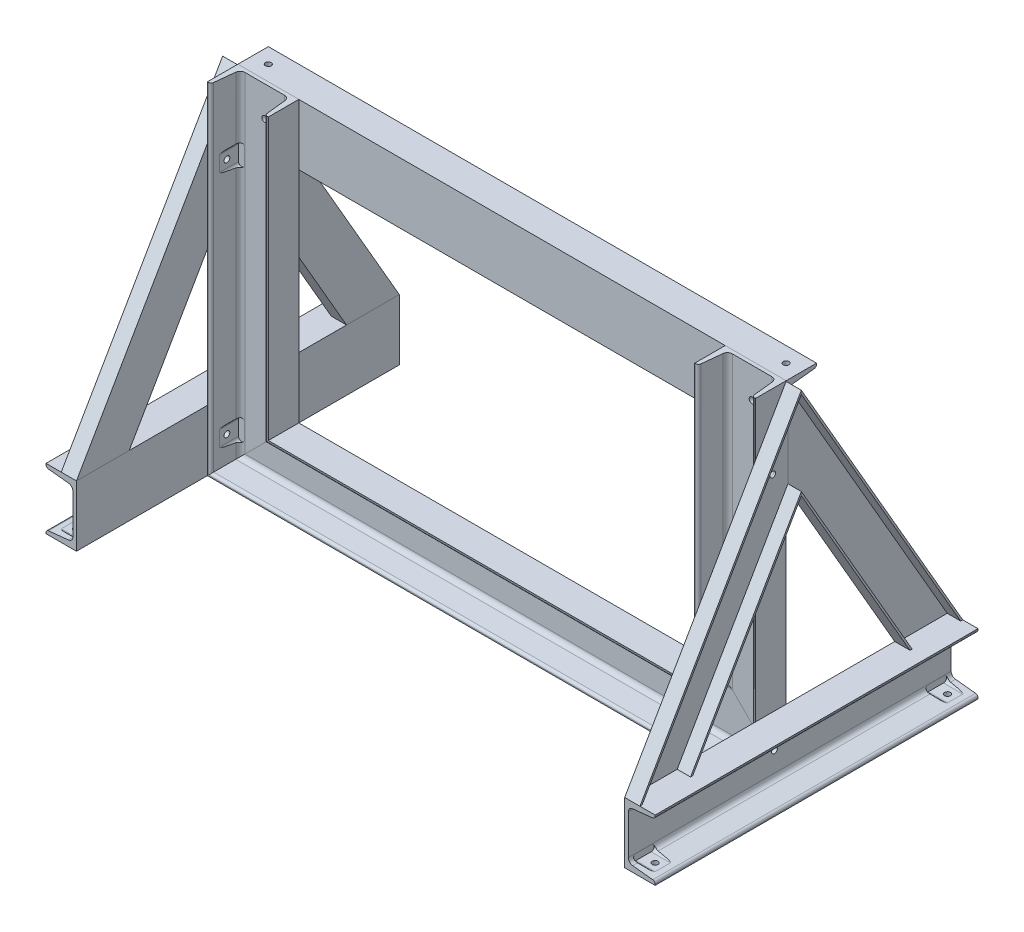
from build123d import *

# Parameters (mm, degrees)
STRUCTURAL_MEMBER1_DEPTH   = 772.803398875
STRUCTURAL_MEMBER1_2_DEPTH = 1325.60679775
STRUCTURAL_MEMBER1_3_DEPTH = 772.803398875
STRUCTURAL_MEMBER1_4_DEPTH = 900
STRUCTURAL_START           = -265
STRUCTURAL_MEMBER2_DEPTH   = 530
STRUCTURAL_MEMBER3_DEPTH   = 674.014380264
STRUCTURAL_MEMBER3_2_DEPTH = 674.014380264
SKETCH19_R                 = 4.7625
CUT_EXTRUDE1_DEPTH         = 30
CUT_EXTRUDE2_DEPTH         = 797.131270583
CUT_EXTRUDE2_DEPTH_BACK    = 797.131270583
SKETCH20_R                 = 4.7625
CUT_EXTRUDE6_DEPTH         = 20
CUT_EXTRUDE6_DEPTH_BACK    = 20
SKETCH22_R                 = 4.7625
CUT_EXTRUDE7_DEPTH         = 20
CUT_EXTRUDE7_DEPTH_BACK    = 20
SKETCH23_R                 = 4.7625
CUT_EXTRUDE8_DEPTH         = 40
CUT_EXTRUDE9_DEPTH         = 1469.354835335
CUT_EXTRUDE10_DEPTH        = 1469.354835353
SKETCH27_R                 = 4.7625
CUT_EXTRUDE11_DEPTH        = 40
CUT_EXTRUDE12_DEPTH        = 729.340398583


# Read off the part's stored shape, not the designer's step: Structural Member2
with BuildPart() as part:
    # Sketch110 → Structural Member1 (new body)
    with BuildSketch(Plane(origin=(-350, 0, 0), x_dir=(0, 0, 1), z_dir=(0, -1, 0))):
        with BuildLine():
            Line((50, 100), (0, 100))
            Line((0, 100), (0, 0))
            Line((0, 0), (50, 0))
            Line((50, 0), (50, 1.629852671))
            ThreePointArc((50, 1.629852671), (48.844151715, 4.6409404), (45.970378085, 6.1052012))
            Line((45.970378085, 6.1052012), (13.063772294, 9.563824837))
            ThreePointArc((13.063772294, 9.563824837), (7.954841396, 12.166955149), (5.9, 17.52))
            Line((5.9, 17.52), (5.9, 82.48))
            ThreePointArc((5.9, 82.48), (7.954841396, 87.833044851), (13.063772294, 90.436175163))
            Line((13.063772294, 90.436175163), (45.970378085, 93.8947988))
            ThreePointArc((45.970378085, 93.8947988), (48.844151715, 95.3590596), (50, 98.370147329))
            Line((50, 98.370147329), (50, 100))
        make_face()
    extrude(amount=STRUCTURAL_MEMBER1_DEPTH)

    # Structural Member1 mitre 1
    split(bisect_by=Plane(origin=(-450, -560, 0), x_dir=(-0.707106781, -0.707106781, 0), z_dir=(-0.707106781, 0.707106781, 0)), keep=Keep.TOP)


with BuildPart() as body_2:
    # Sketch110 on segment 2 (carried to segment 2) → Structural Member1 2 (new body)
    with BuildSketch(Plane(origin=(-662.803398875, -460, 0), x_dir=(0, 0, 1), z_dir=(1, 0, 0))):
        with BuildLine():
            Line((50, 100), (0, 100))
            Line((0, 100), (0, 0))
            Line((0, 0), (50, 0))
            Line((50, 0), (50, 1.629852671))
            ThreePointArc((50, 1.629852671), (48.844151715, 4.6409404), (45.970378085, 6.1052012))
            Line((45.970378085, 6.1052012), (13.063772294, 9.563824837))
            ThreePointArc((13.063772294, 9.563824837), (7.954841396, 12.166955149), (5.9, 17.52))
            Line((5.9, 17.52), (5.9, 82.48))
            ThreePointArc((5.9, 82.48), (7.954841396, 87.833044851), (13.063772294, 90.436175163))
            Line((13.063772294, 90.436175163), (45.970378085, 93.8947988))
            ThreePointArc((45.970378085, 93.8947988), (48.844151715, 95.3590596), (50, 98.370147329))
            Line((50, 98.370147329), (50, 100))
        make_face()
    extrude(amount=STRUCTURAL_MEMBER1_2_DEPTH)

    # Structural Member1 2 mitre 1
    split(bisect_by=Plane(origin=(-450, -560, 0), x_dir=(0.707106781, 0.707106781, 0), z_dir=(0.707106781, -0.707106781, 0)), keep=Keep.TOP)

    # Structural Member1 2 mitre 2
    split(bisect_by=Plane(origin=(450, -560, 0), x_dir=(0.707106781, -0.707106781, 0), z_dir=(-0.707106781, -0.707106781, 0)), keep=Keep.TOP)


with BuildPart() as body_3:
    # Sketch110 on segment 3 (carried to segment 3) → Structural Member1 3 (new body)
    with BuildSketch(Plane(origin=(350, -772.803398875, 0), x_dir=(0, 0, 1), z_dir=(0, 1, 0))):
        with BuildLine():
            Line((50, 100), (0, 100))
            Line((0, 100), (0, 0))
            Line((0, 0), (50, 0))
            Line((50, 0), (50, 1.629852671))
            ThreePointArc((50, 1.629852671), (48.844151715, 4.6409404), (45.970378085, 6.1052012))
            Line((45.970378085, 6.1052012), (13.063772294, 9.563824837))
            ThreePointArc((13.063772294, 9.563824837), (7.954841396, 12.166955149), (5.9, 17.52))
            Line((5.9, 17.52), (5.9, 82.48))
            ThreePointArc((5.9, 82.48), (7.954841396, 87.833044851), (13.063772294, 90.436175163))
            Line((13.063772294, 90.436175163), (45.970378085, 93.8947988))
            ThreePointArc((45.970378085, 93.8947988), (48.844151715, 95.3590596), (50, 98.370147329))
            Line((50, 98.370147329), (50, 100))
        make_face()
    extrude(amount=STRUCTURAL_MEMBER1_3_DEPTH)

    # Structural Member1 3 mitre 1
    split(bisect_by=Plane(origin=(450, -560, 0), x_dir=(-0.707106781, 0.707106781, 0), z_dir=(0.707106781, 0.707106781, 0)), keep=Keep.TOP)


with BuildPart() as body_4:
    # Sketch110 on segment 4 (carried to segment 4) → Structural Member1 4 (new body)
    with BuildSketch(Plane(origin=(-450, -100, 0), x_dir=(0, 0, -1), z_dir=(1, 0, 0))):
        with BuildLine():
            Line((50, 100), (0, 100))
            Line((0, 100), (0, 0))
            Line((0, 0), (50, 0))
            Line((50, 0), (50, 1.629852671))
            ThreePointArc((50, 1.629852671), (48.844151715, 4.6409404), (45.970378085, 6.1052012))
            Line((45.970378085, 6.1052012), (13.063772294, 9.563824837))
            ThreePointArc((13.063772294, 9.563824837), (7.954841396, 12.166955149), (5.9, 17.52))
            Line((5.9, 17.52), (5.9, 82.48))
            ThreePointArc((5.9, 82.48), (7.954841396, 87.833044851), (13.063772294, 90.436175163))
            Line((13.063772294, 90.436175163), (45.970378085, 93.8947988))
            ThreePointArc((45.970378085, 93.8947988), (48.844151715, 95.3590596), (50, 98.370147329))
            Line((50, 98.370147329), (50, 100))
        make_face()
    extrude(amount=STRUCTURAL_MEMBER1_4_DEPTH)


with BuildPart() as body_5:
    # Structural Member2 outline → Structural Member2 (new body)
    with BuildSketch(Plane.XY.offset(STRUCTURAL_START)):
        with BuildLine():
            ThreePointArc((495.970378085, -466.1052012), (498.844151715, -464.6409404), (500, -461.629852671))
            Line((500, -461.629852671), (500, -460))
            Line((500, -460), (450, -460))
            Line((450, -460), (450, -560))
            Line((450, -560), (500, -560))
            Line((500, -560), (500, -558.370147329))
            ThreePointArc((500, -558.370147329), (498.844151715, -555.3590596), (495.970378085, -553.8947988))
            Line((495.970378085, -553.8947988), (463.063772294, -550.436175163))
            ThreePointArc((463.063772294, -550.436175163), (457.954841396, -547.833044851), (455.9, -542.48))
            Line((455.9, -542.48), (455.9, -477.52))
            ThreePointArc((455.9, -477.52), (457.954841396, -472.166955149), (463.063772294, -469.563824837))
            Line((463.063772294, -469.563824837), (495.970378085, -466.1052012))
        make_face()
        with BuildLine():
            Line((-450, -460), (-500, -460))
            Line((-500, -460), (-500, -461.629852671))
            ThreePointArc((-500, -461.629852671), (-498.844151715, -464.6409404), (-495.970378085, -466.1052012))
            Line((-495.970378085, -466.1052012), (-463.063772294, -469.563824837))
            ThreePointArc((-463.063772294, -469.563824837), (-457.954841396, -472.166955149), (-455.9, -477.52))
            Line((-455.9, -477.52), (-455.9, -542.48))
            ThreePointArc((-455.9, -542.48), (-457.954841396, -547.833044851), (-463.063772294, -550.436175163))
            Line((-463.063772294, -550.436175163), (-495.970378085, -553.8947988))
            ThreePointArc((-495.970378085, -553.8947988), (-498.844151715, -555.3590596), (-500, -558.370147329))
            Line((-500, -558.370147329), (-500, -560))
            Line((-500, -560), (-450, -560))
            Line((-450, -560), (-450, -460))
        make_face()
    extrude(amount=STRUCTURAL_MEMBER2_DEPTH)

    # Sketch19 → Cut-Extrude1 (cut)
    with BuildSketch(Plane(origin=(-1080, -560, -820.205064642), x_dir=(0, 0, -1), z_dir=(0, 1, 0))):
        with Locations(Location((-1060.205064642, -605, 0), (0, 0, 90))):
            Circle(SKETCH19_R)
        with Locations(Location((-1060.205064642, -1555, 0), (0, 0, 270))):
            Circle(SKETCH19_R)
        with Locations(Location((-580.205064642, -1555, 0), (0, 0, 270))):
            Circle(SKETCH19_R)
        with Locations(Location((-580.205064642, -605, 0), (0, 0, 270))):
            Circle(SKETCH19_R)
    extrude(amount=CUT_EXTRUDE1_DEPTH, mode=Mode.SUBTRACT)


with BuildPart() as body_6:
    # Sketch112 → Structural Member3 (new body)
    with BuildSketch(Plane(origin=(-450, -478.75, 232.524047358), x_dir=(3.766735246327483e-15, 0.5000000000000071, 0.8660254037844346), z_dir=(1.9674048701886844e-15, 0.8660254037844346, -0.5000000000000071))):
        Polygon((-37.5, 0), (37.5, 0), (37.5, -25), (34.5, -25), (34.5, -3), (-34.5, -3), (-34.5, -25), (-37.5, -25), align=None)
    extrude(amount=STRUCTURAL_MEMBER3_DEPTH)

    # Structural Member3 mitre 1
    split(bisect_by=Plane(origin=(-450, -1.006535994, 0), x_dir=(0, -1, 0), z_dir=(0, 0, 1)), keep=Keep.TOP)

    # Trim_Extend1 13
    split(bisect_by=Plane(origin=(-475, -460, 0), x_dir=(-1, 0, 0), z_dir=(0, 1, 0)), keep=Keep.TOP)


with BuildPart() as body_7:
    # Sketch112 on segment 2 (carried to segment 2) → Structural Member3 2 (new body)
    with BuildSketch(Plane(origin=(-450, 104.963575824, 104.483142774), x_dir=(0, 0.5, -0.866025404), z_dir=(0, -0.866025404, -0.5))):
        Polygon((-37.5, 0), (37.5, 0), (37.5, -25), (34.5, -25), (34.5, -3), (-34.5, -3), (-34.5, -25), (-37.5, -25), align=None)
    extrude(amount=STRUCTURAL_MEMBER3_2_DEPTH)

    # Structural Member3 2 mitre 1
    split(bisect_by=Plane(origin=(-450, -1.006535994, 0), x_dir=(0, 1, 0), z_dir=(0, 0, -1)), keep=Keep.TOP)

    # Trim_Extend1 9
    split(bisect_by=Plane(origin=(475, -460, 0), x_dir=(-1, 0, 0), z_dir=(0, 1, 0)), keep=Keep.TOP)


with BuildPart() as body_8:
    # Mirror1: mirrored copy
    add(body_6.part.mirror(Plane(origin=(0, 0, 0), x_dir=(0, 0, 1), z_dir=(1, 0, 0))))


with BuildPart() as body_9:
    # Mirror1 2: mirrored copy
    add(body_7.part.mirror(Plane(origin=(0, 0, 0), x_dir=(0, 0, 1), z_dir=(1, 0, 0))))


with BuildPart() as cut_extrude2_tool:
    # Sketch20 → Cut-Extrude2 (new, two sides: drawn at the far end of the back side and taken through both)
    with BuildSketch(Plane.XY.offset(-CUT_EXTRUDE2_DEPTH_BACK)):
        with Locations((-400, -50)):
            Circle(SKETCH20_R)
        with Locations((400, -50)):
            Circle(SKETCH20_R)
    extrude(amount=CUT_EXTRUDE2_DEPTH + CUT_EXTRUDE2_DEPTH_BACK)


with BuildPart() as part_1:
    add(part.part)

    # Cut-Extrude2: cut by cut_extrude2_tool
    add(cut_extrude2_tool.part, mode=Mode.SUBTRACT)


with BuildPart() as body_3_1:
    add(body_3.part)

    # Cut-Extrude2: cut by cut_extrude2_tool
    add(cut_extrude2_tool.part, mode=Mode.SUBTRACT)


with BuildPart() as body_4_1:
    add(body_4.part)

    # Cut-Extrude2: cut by cut_extrude2_tool
    add(cut_extrude2_tool.part, mode=Mode.SUBTRACT)

    # Sketch27 → Cut-Extrude11 (cut)
    with BuildSketch(Plane(origin=(0, 0, -50), x_dir=(1, 0, 0), z_dir=(0, -1, 0))):
        with Locations(Location((-425, 25, 0), (0, 0, 270))):
            Circle(SKETCH27_R)
        with Locations(Location((425, 25, 0), (0, 0, 90))):
            Circle(SKETCH27_R)
    extrude(amount=CUT_EXTRUDE11_DEPTH, mode=Mode.SUBTRACT)

    # Sketch28 → Cut-Extrude12 (cut, through all)
    with BuildSketch(Plane(origin=(0, -104.925361996, -5.9), x_dir=(-1, 0, 0), z_dir=(0, 0, 1))):
        with BuildLine():
            Line((-437.5, -88.441022575), (-412.5, -88.441022575))
            ThreePointArc((-412.5, -88.441022575), (-407.5, -93.441022575), (-412.5, -98.441022575))
            Line((-412.5, -98.441022575), (-437.5, -98.441022575))
            ThreePointArc((-437.5, -98.441022575), (-442.5, -93.441022575), (-437.5, -88.441022575))
        make_face()
        with BuildLine():
            Line((437.5, -88.441022575), (412.5, -88.441022575))
            ThreePointArc((412.5, -88.441022575), (407.5, -93.441022575), (412.5, -98.441022575))
            Line((412.5, -98.441022575), (437.5, -98.441022575))
            ThreePointArc((437.5, -98.441022575), (442.5, -93.441022575), (437.5, -88.441022575))
        make_face()
    extrude(amount=-CUT_EXTRUDE12_DEPTH, mode=Mode.SUBTRACT)


with BuildPart() as cut_extrude6_tool:
    # Sketch22 → Cut-Extrude6 (new, two sides: drawn at the far end of the back side and taken through both)
    with BuildSketch(Plane(origin=(-455.9, -935.9, 0), x_dir=(0, 0, -1), z_dir=(1, 0, 0)).offset(-CUT_EXTRUDE6_DEPTH_BACK)):
        with Locations(Location((-25, 816.592193817, 0), (0, 0, 270))):
            Circle(SKETCH22_R)
        with Locations(Location((-25, 425.9, 0), (0, 0, 270))):
            Circle(SKETCH22_R)
    extrude(amount=CUT_EXTRUDE6_DEPTH + CUT_EXTRUDE6_DEPTH_BACK)


with BuildPart() as part_2:
    add(part_1.part)

    # Cut-Extrude6: cut by cut_extrude6_tool
    add(cut_extrude6_tool.part, mode=Mode.SUBTRACT)


with BuildPart() as body_5_1:
    add(body_5.part)

    # Cut-Extrude6: cut by cut_extrude6_tool
    add(cut_extrude6_tool.part, mode=Mode.SUBTRACT)


with BuildPart() as body_6_1:
    add(body_6.part)

    # Cut-Extrude6: cut by cut_extrude6_tool
    add(cut_extrude6_tool.part, mode=Mode.SUBTRACT)


with BuildPart() as cut_extrude7_tool:
    # Sketch23 → Cut-Extrude7 (new, two sides: drawn at the far end of the back side and taken through both)
    with BuildSketch(Plane(origin=(455.9, -935.9, 0), x_dir=(0, 0, 1), z_dir=(-1, 0, 0)).offset(-CUT_EXTRUDE7_DEPTH_BACK)):
        with Locations(Location((25, 816.592193817, 0), (0, 0, 90))):
            Circle(SKETCH23_R)
        with Locations(Location((25, 425.9, 0), (0, 0, 90))):
            Circle(SKETCH23_R)
    extrude(amount=CUT_EXTRUDE7_DEPTH + CUT_EXTRUDE7_DEPTH_BACK)


with BuildPart() as body_3_2:
    add(body_3_1.part)

    # Cut-Extrude7: cut by cut_extrude7_tool
    add(cut_extrude7_tool.part, mode=Mode.SUBTRACT)


with BuildPart() as body_5_2:
    add(body_5_1.part)

    # Cut-Extrude7: cut by cut_extrude7_tool
    add(cut_extrude7_tool.part, mode=Mode.SUBTRACT)

    # Sketch25 → Cut-Extrude9 (cut, through all)
    with BuildSketch(Plane(origin=(455.9, -1082.63387728, 0), x_dir=(0, 0, -1), z_dir=(-1, 0, 0))):
        with BuildLine():
            Line((252.5, -539.63387728), (227.5, -539.63387728))
            ThreePointArc((227.5, -539.63387728), (222.5, -534.63387728), (227.5, -529.63387728))
            Line((227.5, -529.63387728), (252.5, -529.63387728))
            ThreePointArc((252.5, -529.63387728), (257.5, -534.63387728), (252.5, -539.63387728))
        make_face()
        with BuildLine():
            Line((-252.5, -539.63387728), (-227.5, -539.63387728))
            ThreePointArc((-227.5, -539.63387728), (-222.5, -534.63387728), (-227.5, -529.63387728))
            Line((-227.5, -529.63387728), (-252.5, -529.63387728))
            ThreePointArc((-252.5, -529.63387728), (-257.5, -534.63387728), (-252.5, -539.63387728))
        make_face()
    extrude(amount=-CUT_EXTRUDE9_DEPTH, mode=Mode.SUBTRACT)

    # Sketch26 → Cut-Extrude10 (cut, through all)
    with BuildSketch(Plane(origin=(-455.9, -1082.63387728, 0), x_dir=(0, 0, 1), z_dir=(1, 0, 0))):
        with BuildLine():
            Line((-252.5, -539.63387728), (-227.5, -539.63387728))
            ThreePointArc((-227.5, -539.63387728), (-222.5, -534.63387728), (-227.5, -529.63387728))
            Line((-227.5, -529.63387728), (-252.5, -529.63387728))
            ThreePointArc((-252.5, -529.63387728), (-257.5, -534.63387728), (-252.5, -539.63387728))
        make_face()
        with BuildLine():
            Line((227.5, -539.63387728), (252.5, -539.63387728))
            ThreePointArc((252.5, -539.63387728), (257.5, -534.63387728), (252.5, -529.63387728))
            Line((252.5, -529.63387728), (227.5, -529.63387728))
            ThreePointArc((227.5, -529.63387728), (222.5, -534.63387728), (227.5, -539.63387728))
        make_face()
    extrude(amount=-CUT_EXTRUDE10_DEPTH, mode=Mode.SUBTRACT)


with BuildPart() as body_8_1:
    add(body_8.part)

    # Cut-Extrude7: cut by cut_extrude7_tool
    add(cut_extrude7_tool.part, mode=Mode.SUBTRACT)


with BuildPart() as cut_extrude8_tool:
    # Sketch24 → Cut-Extrude8 (new body)
    with BuildSketch(Plane(origin=(-392.112446475, 0, 5.9), x_dir=(-1, 0, 0), z_dir=(0, 0, -1))):
        with BuildLine():
            Line((40.887553525, -522.5), (40.887553525, -497.5))
            ThreePointArc((40.887553525, -497.5), (45.887553525, -492.5), (50.887553525, -497.5))
            Line((50.887553525, -497.5), (50.887553525, -522.5))
            ThreePointArc((50.887553525, -522.5), (45.887553525, -527.5), (40.887553525, -522.5))
        make_face()
        with BuildLine():
            Line((40.887553525, -131.807806183), (40.887553525, -106.807806183))
            ThreePointArc((40.887553525, -106.807806183), (45.887553525, -101.807806183), (50.887553525, -106.807806183))
            Line((50.887553525, -106.807806183), (50.887553525, -131.807806183))
            ThreePointArc((50.887553525, -131.807806183), (45.887553525, -136.807806183), (40.887553525, -131.807806183))
        make_face()
        with BuildLine():
            Line((-825.112446475, -522.5), (-825.112446475, -497.5))
            ThreePointArc((-825.112446475, -497.5), (-830.112446475, -492.5), (-835.112446475, -497.5))
            Line((-835.112446475, -497.5), (-835.112446475, -522.5))
            ThreePointArc((-835.112446475, -522.5), (-830.112446475, -527.5), (-825.112446475, -522.5))
        make_face()
        with BuildLine():
            Line((-825.112446475, -131.807806183), (-825.112446475, -106.807806183))
            ThreePointArc((-825.112446475, -106.807806183), (-830.112446475, -101.807806183), (-835.112446475, -106.807806183))
            Line((-835.112446475, -106.807806183), (-835.112446475, -131.807806183))
            ThreePointArc((-835.112446475, -131.807806183), (-830.112446475, -136.807806183), (-825.112446475, -131.807806183))
        make_face()
    extrude(amount=-CUT_EXTRUDE8_DEPTH)


with BuildPart() as part_3:
    add(part_2.part)

    # Cut-Extrude8: cut by cut_extrude8_tool
    add(cut_extrude8_tool.part, mode=Mode.SUBTRACT)


with BuildPart() as body_3_3:
    add(body_3_2.part)

    # Cut-Extrude8: cut by cut_extrude8_tool
    add(cut_extrude8_tool.part, mode=Mode.SUBTRACT)


solid = Compound([body_2.part, body_7.part, body_9.part, body_4_1.part, body_6_1.part, body_5_2.part, body_8_1.part, part_3.part, body_3_3.part])
